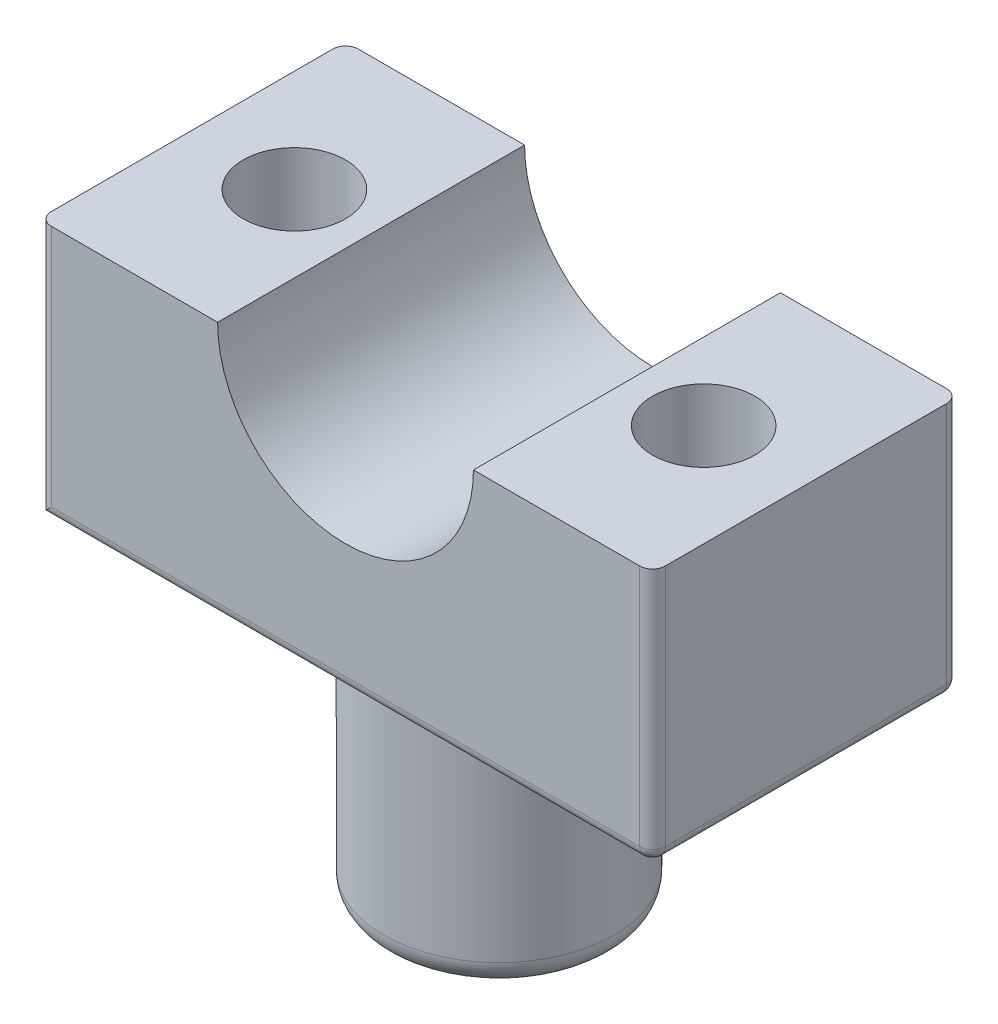
from build123d import *

# Parameters (mm, degrees)
BOSS_EXTRUDE1_DEPTH = 12
SKETCH2_R           = 2
CUT_EXTRUDE1_DEPTH  = 29.635642127
SKETCH3_R           = 4.5
SKETCH3_R_2         = 2.5
BOSS_EXTRUDE2_DEPTH = 10
FILLET1_R           = 1
FILLET2_R           = 0.5


with BuildPart() as part:
    # Sketch1 → Boss-Extrude1 (new body)
    with BuildSketch(Plane.XY):
        with BuildLine():
            Line((17, 10), (24, 10))
            Line((24, 10), (24, 0))
            Line((24, 0), (0, 0))
            Line((0, 0), (0, 10))
            Line((0, 10), (7, 10))
            ThreePointArc((7, 10), (12, 5), (17, 10))
        make_face()
    extrude(amount=BOSS_EXTRUDE1_DEPTH)

    # Sketch2 → Cut-Extrude1 (cut, through all)
    with BuildSketch(Plane(origin=(0, 10, 0), x_dir=(1, 0, 0), z_dir=(0, 1, 0))):
        with Locations(Location((4, -6, 0), (0, 0, 270))):
            Circle(SKETCH2_R)
        with Locations(Location((20, -6, 0), (0, 0, 270))):
            Circle(SKETCH2_R)
    extrude(amount=-CUT_EXTRUDE1_DEPTH, mode=Mode.SUBTRACT)

    # Sketch3 → Boss-Extrude2 (add)
    with BuildSketch(Plane.XZ):
        with Locations(Location((12, 6, 0), (0, 0, 90))):
            Circle(SKETCH3_R)
        with Locations(Location((12, 6, 0), (0, 0, 270))):
            Circle(SKETCH3_R_2, mode=Mode.SUBTRACT)
    extrude(amount=BOSS_EXTRUDE2_DEPTH)

    # Fillet1
    fillet1_edges = [part.edges().sort_by_distance(p)[0] for p in [
        (12, 0, 1.5),
        (12, -10, 1.5),
    ]]
    fillet(fillet1_edges, radius=FILLET1_R)

    # Fillet2
    fillet2_edges = [part.edges().sort_by_distance(p)[0] for p in [
        (24, 0, 6),
        (24, 5, 12),
        (0, 5, 12),
        (24, 5, 0),
        (12, 0, 0),
        (0, 5, 0),
        (12, 0, 12),
    ]]
    fillet(fillet2_edges, radius=FILLET2_R - 0.0001)  # a hair under: the kernel refuses the full size


solid = part.part
